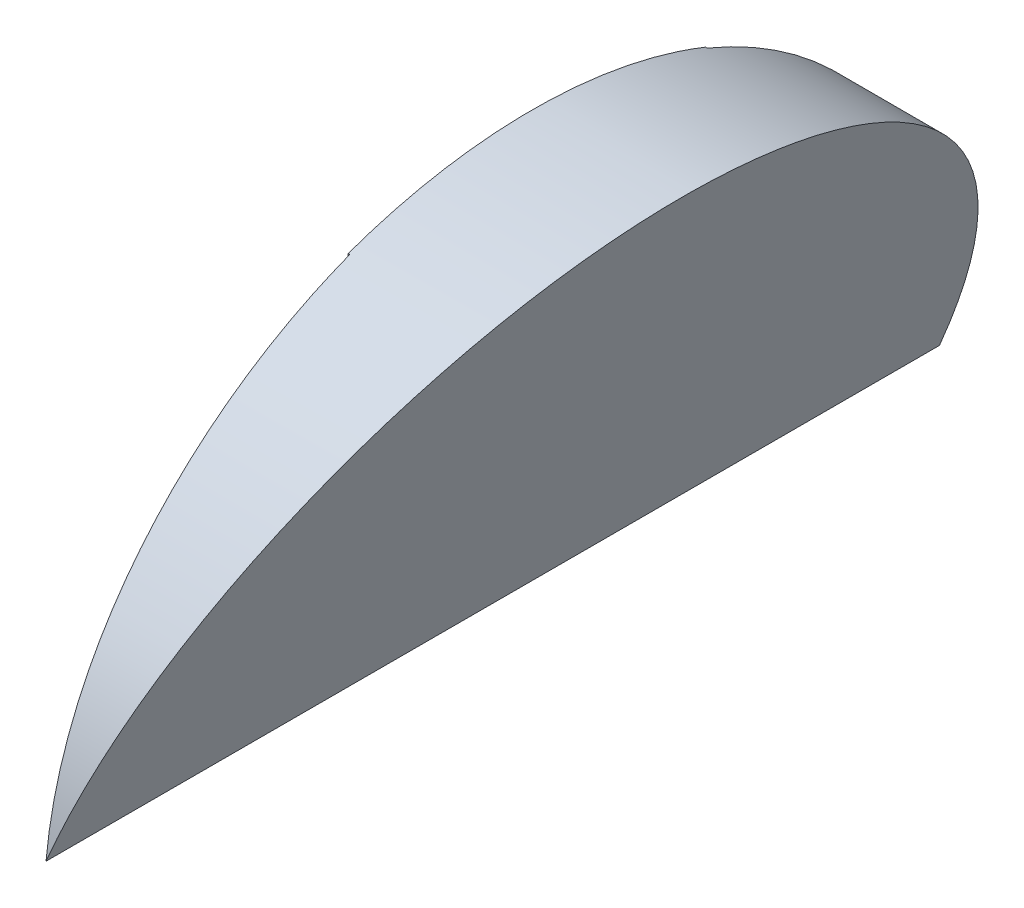
from build123d import *

# Parameters (mm, degrees)
EXTRUDE_1_DEPTH      = 80
EXTRUDE_1_DEPTH_BACK = 80
EXTRUDE_2_DEPTH      = 32
EXTRUDE_2_DEPTH_BACK = 32
CUT_EXTRUDE_6_DEPTH  = 33.957985297
CUT_EXTRUDE_START    = -22
SKETCH_14_W          = 51
SKETCH_14_H          = 3
CUT_EXTRUDE_7_DEPTH  = 98.020555692


# Read off the part's stored shape, not the designer's step: Вырез-Вытянуть6
with BuildPart() as part:
    # Эскиз11 → Бобышка-Вытянуть1 (new, two sides: drawn at the far end of the back side and taken through both)
    with BuildSketch(Plane.XY.offset(-EXTRUDE_1_DEPTH_BACK)):
        Polygon((0, 0), (33.957985297, 80), (6.999093082, 80), align=None)
    extrude(amount=EXTRUDE_1_DEPTH + EXTRUDE_1_DEPTH_BACK)

    # Эскиз13 → Бобышка-Вытянуть2 (add, two sides: drawn at the far end of the back side and taken through both)
    with BuildSketch(Plane.XY.offset(-EXTRUDE_2_DEPTH_BACK)):
        Polygon((6.999093082, 80), (-3, 4), (0, 0), align=None)
    extrude(amount=EXTRUDE_2_DEPTH + EXTRUDE_2_DEPTH_BACK)

    # Вырез-Вытянуть6 outline → Вырез-Вытянуть6 (cut)
    with BuildSketch(Plane(origin=(0, 0, 0), x_dir=(0, 0, -1), z_dir=(1, 0, 0))):
        with BuildLine():
            Line((-80, 80), (-80, 0))
            ThreePointArc((-80, 0), (-56.568542382, 56.568542608), (3.2e-07, 80))
            Line((3.2e-07, 80), (-80, 80))
        make_face()
        with BuildLine():
            ThreePointArc((3.2e-07, 80), (56.568542608, 56.568542382), (80, 0))
            Line((80, 0), (80, 80))
            Line((80, 80), (3.2e-07, 80))
        make_face()
    extrude(amount=CUT_EXTRUDE_6_DEPTH, mode=Mode.SUBTRACT)

    # Эскиз14 → Вырез-Вытянуть7 (cut, through all)
    with BuildSketch(Plane(origin=(33.957985297, 0, 0), x_dir=(0, 0, -1), z_dir=(1, 0, 0)).offset(CUT_EXTRUDE_START)):
        with Locations((0, 71.5)):
            Rectangle(SKETCH_14_W, SKETCH_14_H)
        with Locations((0, 65.5)):
            Rectangle(SKETCH_14_W, SKETCH_14_H)
    extrude(amount=-CUT_EXTRUDE_7_DEPTH, mode=Mode.SUBTRACT)


solid = part.part
